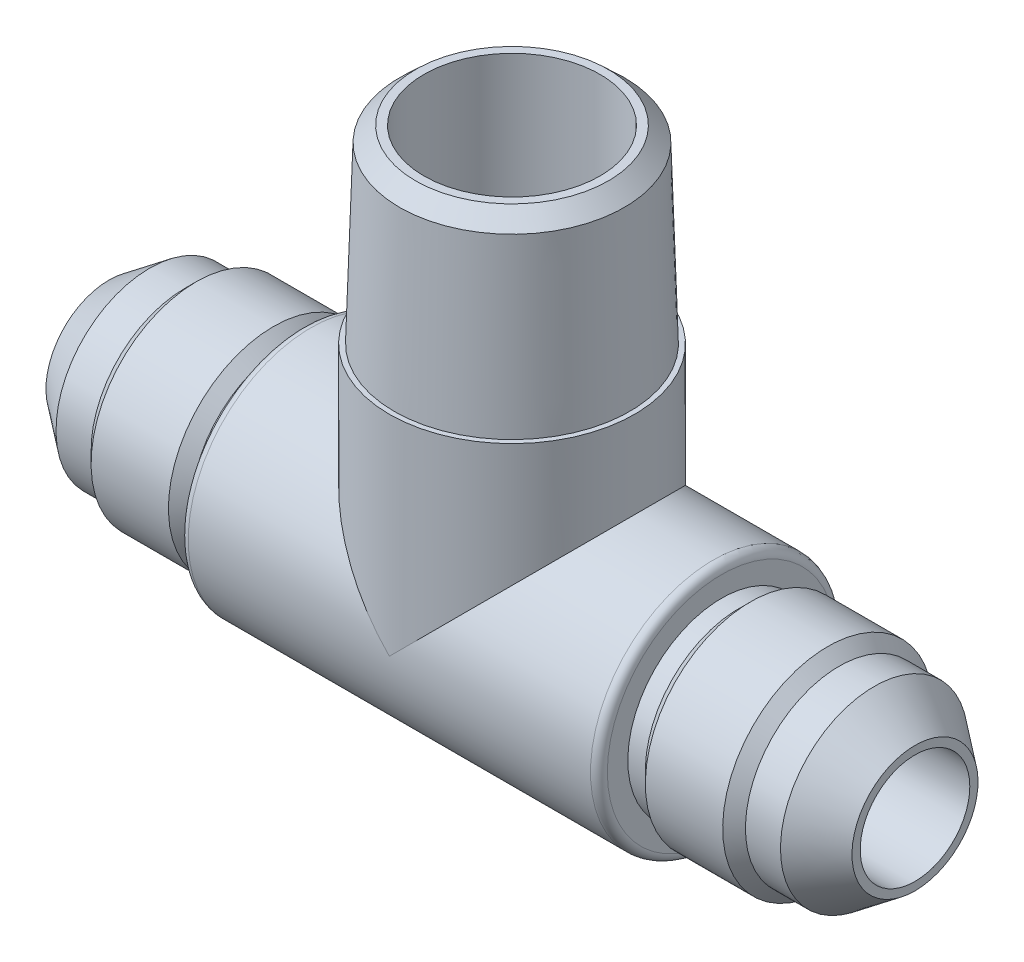
from build123d import *
from build123d.topology import SkipClean

# Parameters (mm, degrees)
SKETCH2_R           = 9.525
EXTRUDE1_DEPTH      = 17.526
SKETCH15_R          = 11.1125
BOSS_EXTRUDE1_DEPTH = 18.9865
SKETCH16_R          = 4.9657
CUT_EXTRUDE1_DEPTH  = 40.750949281
SKETCH20_R          = 11.1125
BOSS_EXTRUDE2_DEPTH = 18.9865
SKETCH22_R          = 10.668
BOSS_EXTRUDE3_DEPTH = 17.12976
BOSS_EXTRUDE3_TAPER = 1.75
CHAMFER1_SIZE       = 1.360714286
CHAMFER1_SIZE_2     = 1.404253042
SKETCH25_R          = 10.668
BOSS_EXTRUDE4_DEPTH = 17.12976
BOSS_EXTRUDE4_DRAFT = -15
SKETCH28_R          = 7.978385455
CUT_EXTRUDE6_DEPTH  = 17.12976
FILLET1_R           = 0.762
CIRPATTERN1_COUNT   = 2
CIRPATTERN1_ANGLE   = 180
SKETCH26_R          = 4.9657
CUT_EXTRUDE4_DEPTH  = 83.22239678
SKETCH29_R          = 4.9657
CUT_EXTRUDE7_DEPTH  = 53.545547444


with BuildPart() as part:
    # Sketch2 → Extrude1 (new body)
    with BuildSketch(Plane(origin=(-36.5125, 0, 0), x_dir=(0, 0, -1), z_dir=(1, 0, 0))):
        Circle(SKETCH2_R)
    extrude(amount=EXTRUDE1_DEPTH)

    # Sketch5 → Cut-Revolve1 (revolve, cut)
    with BuildSketch(Plane.XY):
        Polygon((-32.818891687, 8.493888504), (-29.643891687, 8.493888504), (-28.612780191, 9.525), (-36.5125, 9.525), (-36.5125, 5.710555), align=None)
        Polygon((-18.9865, 8.493888504), (-20.574, 8.493888504), (-21.605111496, 9.525), (-18.9865, 9.525), align=None)
    revolve(axis=Axis((0, 0, 0), (-1, 0, 0)), mode=Mode.SUBTRACT)

    # Sketch15 → Boss-Extrude1 (add)
    with BuildSketch(Plane(origin=(-18.9865, 0, 0), x_dir=(0, 0, -1), z_dir=(1, 0, 0))):
        Circle(SKETCH15_R)
    extrude(amount=BOSS_EXTRUDE1_DEPTH)

    # Sketch16 → Cut-Extrude1 (cut, through all)
    with BuildSketch(Plane(origin=(0, 0, 0), x_dir=(0, 0, -1), z_dir=(1, 0, 0))):
        Circle(SKETCH16_R)
    extrude(amount=-CUT_EXTRUDE1_DEPTH, mode=Mode.SUBTRACT)

    # Fillet1
    fillet1_edges = [part.edges().sort_by_distance(p)[0] for p in [
        (-18.9865, 0, 11.1125),
    ]]
    fillet(fillet1_edges, radius=FILLET1_R)


with BuildPart() as body_2:
    # Sketch20 → Boss-Extrude2 (new body)
    with BuildSketch(Plane(origin=(0, 18.9865, 0), x_dir=(-1, 0, 0), z_dir=(0, 1, 0))):
        with Locations(Location((0, 0, 0), (0, 0, 90))):
            Circle(SKETCH20_R)
    extrude(amount=-BOSS_EXTRUDE2_DEPTH)


with BuildPart() as body_3:
    # Sketch22 → Boss-Extrude3 (new body)
    with BuildSketch(Plane(origin=(0, 18.9865, 0), x_dir=(-1, 0, 0), z_dir=(0, 1, 0))):
        Circle(SKETCH22_R)
    extrude(amount=BOSS_EXTRUDE3_DEPTH, taper=BOSS_EXTRUDE3_TAPER)

    # Chamfer1
    # the kernel refuses this chamfer: 1.404253042, 1.360714286 mm, written as the material it takes off along each edge
    with BuildSketch(Plane(origin=(0, 36.11626, 0), x_dir=(-1, 0, 0), z_dir=(0, 0, 1))) as chamfer1_piece_1:
        Polygon((10.144638497 + CHAMFER1_SIZE * 0.0305385132034, CHAMFER1_SIZE * 0.999533590627), (10.144638497 - CHAMFER1_SIZE_2, 0), (10.144638497, 0), align=None)
    revolve(axis=Axis((0, 36.11626, 0), (0, -1, 0)), mode=Mode.SUBTRACT)


with BuildPart() as boss_extrude4_tool:
    # Sketch25 → Boss-Extrude4 (with draft: the straight prism first)
    with BuildSketch(Plane.XZ.offset(-18.9865)):
        Circle(SKETCH25_R)
    extrude(amount=-BOSS_EXTRUDE4_DEPTH)
    # Boss-Extrude4: the draft: its side faces are tilted about the plane it starts from
    boss_extrude4_sides = [boss_extrude4_tool.faces().sort_by_distance(p)[0] for p in [
        (-10.668, 27.55138, 0),
    ]]
    draft(boss_extrude4_sides, Plane.XZ.offset(-18.9865), BOSS_EXTRUDE4_DRAFT)


with BuildPart() as body_3_1:
    add(body_3.part)

    # Boss-Extrude4: add boss_extrude4_tool
    add(boss_extrude4_tool.part)

    # Sketch28 → Cut-Extrude6 (cut)
    with BuildSketch(Plane(origin=(0, 36.11626, 0), x_dir=(1, 0, 0), z_dir=(0, 1, 0))):
        with Locations(Location((0, 0, 0), (0, 0, 270))):
            Circle(SKETCH28_R)
    extrude(amount=-CUT_EXTRUDE6_DEPTH, mode=Mode.SUBTRACT)


with BuildPart() as cirpattern1_1:
    # CirPattern1: pattern copy
    add(part.part.rotate(Axis((0, 0, 12.651043997), (0, 0, -1)), 1 * CIRPATTERN1_ANGLE / (CIRPATTERN1_COUNT - 1)))


with BuildPart() as part_1:
    add(part.part)

    # Combine2: union body 3, body 2, CirPattern1_1
    add(body_3_1.part)
    add(body_2.part)
    add(cirpattern1_1.part)

    # Sketch30 → Revolve1 (revolve)
    with SkipClean():  # the faces are left unmerged after this step: merging them gives an invalid solid
        with BuildSketch(Plane.XY, mode=Mode.PRIVATE) as revolve1_sk:
            with BuildLine():
                Line((0, 18.9865), (0, 9.49325))
                ThreePointArc((0, 9.49325), (-5.981989992, 13.352586812), (-10.922, 18.4785))
                Line((-10.922, 18.4785), (-10.922, 18.9865))
                Line((-10.922, 18.9865), (0, 18.9865))
            make_face()
        revolve(revolve1_sk.sketch.rotate(Axis((0, 18.9865, 0), (0, -1, 0)), 270), axis=Axis((0, 18.9865, 0), (0, -1, 0)))

    # Sketch26 → Cut-Extrude4 (cut, through all)
    with SkipClean():  # the faces are left unmerged after this step: merging them gives an invalid solid
        with BuildSketch(Plane.ZY.offset(36.5125)):
            with Locations(Location((0, 0, 0), (0, 0, 180))):
                Circle(SKETCH26_R)
        extrude(amount=-CUT_EXTRUDE4_DEPTH, mode=Mode.SUBTRACT)

    # Sketch29 → Cut-Extrude7 (cut, through all)
    with SkipClean():  # the faces are left unmerged after this step: merging them gives an invalid solid
        with BuildSketch(Plane(origin=(0, 0, 0), x_dir=(1, 0, 0), z_dir=(0, 1, 0))):
            with Locations(Location((0, 0, 0), (0, 0, 270))):
                Circle(SKETCH29_R)
        extrude(amount=CUT_EXTRUDE7_DEPTH, mode=Mode.SUBTRACT)


solid = part_1.part
